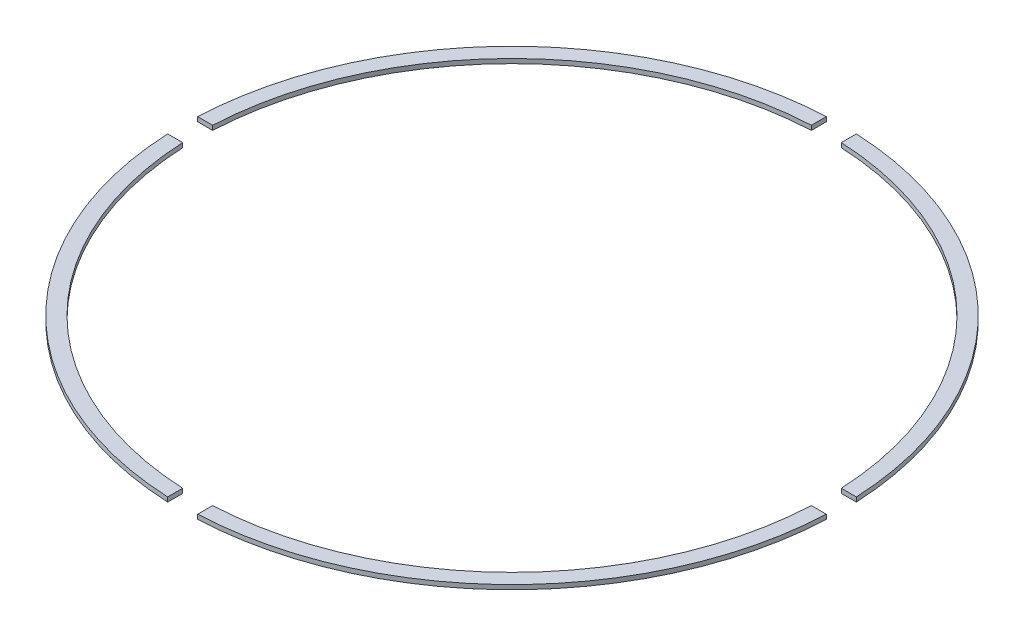
from build123d import *

# Parameters (mm, degrees)
SKETCH1_R            = 220
SKETCH1_R_2          = 210
BOSS_EXTRUDE1_DEPTH  = 1.5
QUADRUPLE_DEPTH      = 312.130599588
QUADRUPLE_DEPTH_BACK = 312.130599588
SKETCH2_W            = 20
SKETCH2_H            = 440
SKETCH2_W_2          = 440
SKETCH2_H_2          = 20


with BuildPart() as part:
    # Sketch1 → Boss-Extrude1 (new, symmetric)
    with BuildSketch(Plane(origin=(0, 0, 0), x_dir=(1, 0, 0), z_dir=(0, 1, 0))):
        Circle(SKETCH1_R)
        Circle(SKETCH1_R_2, mode=Mode.SUBTRACT)
    extrude(amount=BOSS_EXTRUDE1_DEPTH, both=True)

    # Sketch2 → quadruple (cut, two sides: drawn at the far end of the back side and taken through both)
    with BuildSketch(Plane(origin=(0, 0, 0), x_dir=(1, 0, 0), z_dir=(0, 1, 0)).offset(-QUADRUPLE_DEPTH_BACK)):
        Rectangle(SKETCH2_W, SKETCH2_H)
        Rectangle(SKETCH2_W_2, SKETCH2_H_2)
    extrude(amount=QUADRUPLE_DEPTH + QUADRUPLE_DEPTH_BACK, mode=Mode.SUBTRACT)


with BuildPart() as quadruple_piece_1:
    # of the separate pieces the step leaves, piece 1, a body of its own (quadruple_pieces)
    add(part.part.solids().sort_by_distance((10, -1.5, 219.772609758))[0])


with BuildPart() as quadruple_piece_2:
    # of the separate pieces the step leaves, piece 2, a body of its own (quadruple_pieces)
    add(part.part.solids().sort_by_distance((219.772609758, -1.5, -10))[0])


with BuildPart() as quadruple_piece_3:
    # of the separate pieces the step leaves, piece 3, a body of its own (quadruple_pieces)
    add(part.part.solids().sort_by_distance((-10, 1.5, -209.761769634))[0])


with BuildPart() as quadruple_piece_4:
    # of the separate pieces the step leaves, piece 4, a body of its own (quadruple_pieces)
    add(part.part.solids().sort_by_distance((-219.772609758, 1.5, 10))[0])


solid = Compound([quadruple_piece_1.part, quadruple_piece_2.part, quadruple_piece_3.part, quadruple_piece_4.part])
